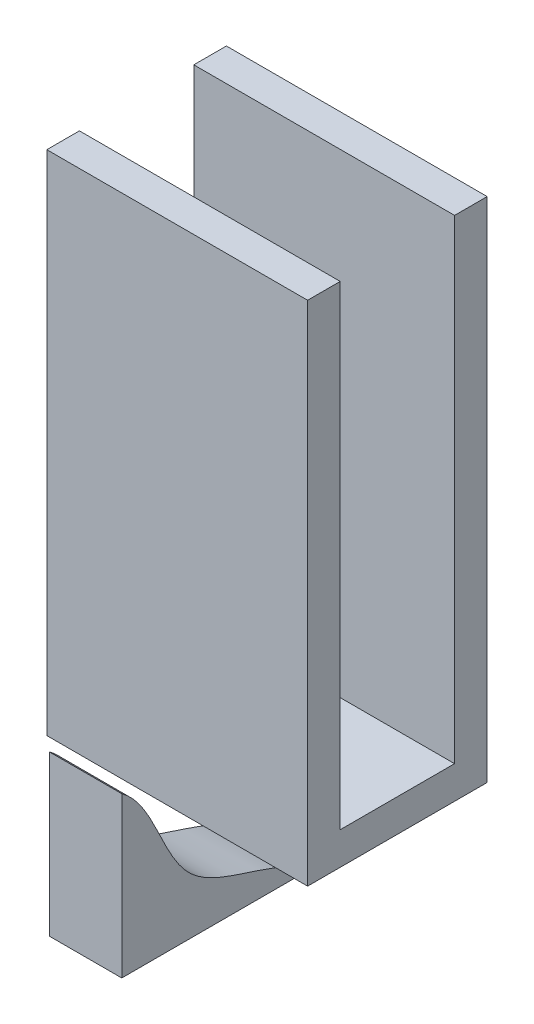
from build123d import *

# Parameters (mm, degrees)
EXTRUDE_5_DEPTH      = 30
EXTRUDE_5_DEPTH_BACK = 30
F_1_FR_R             = 5
EXTRUDE_6_DEPTH      = 20
EXTRUDE_6_DEPTH_BACK = 20
OTHER_START          = -15
OTHER_2_DEPTH        = 30


# Read off the part's stored shape, not the designer's step: Отступ2
with BuildPart() as part:
    # Эскиз1_fr → Бобышка-Вытянуть5 (new, two sides: drawn at the far end of the back side and taken through both)
    with BuildSketch(Plane.XY.offset(-EXTRUDE_5_DEPTH_BACK)):
        with BuildLine():
            Line((-5.557606452, -13.932444528), (-5.557606452, -62.642280008))
            Line((-5.557606452, -62.642280008), (5.557606452, -62.642280008))
            Line((5.557606452, -62.642280008), (5.557606452, -13.932444528))
            ThreePointArc((5.557606452, -13.932444528), (0, 15), (-5.557606452, -13.932444528))
        make_face()
        Circle(F_1_FR_R, mode=Mode.SUBTRACT)
    extrude(amount=EXTRUDE_5_DEPTH + EXTRUDE_5_DEPTH_BACK)

    # Отступ2 outline → Отступ2 (cut)
    with BuildSketch(Plane.YZ.offset(OTHER_START)):
        with BuildLine():
            Line((16, 30), (-38.162129208, 30.000000201))
            add(Edge.make_bspline(
                [(-38.162129208, 30.000000201), (-38.350412386, 29.738589195), (-38.547242858, 29.484853366), (-38.752299072, 29.238505312), (-38.965259498, 28.99925828), (-39.185802485, 28.766826159), (-39.413606123, 28.540923423), (-39.64834813, 28.32126501), (-39.889705768, 28.107566173), (-40.137355811, 27.899542297), (-40.39097457, 27.696908743), (-40.650238001, 27.499380765), (-40.914821881, 27.306673579), (-41.184402075, 27.11850268), (-42.265778691, 26.393314992), (-43.113368902, 25.888872388), (-43.99315142, 25.414009108), (-44.896841535, 24.96146191), (-45.816149017, 24.523958449), (-46.742782565, 24.094220219), (-47.668453227, 23.664962906), (-48.584876381, 23.228895124), (-49.483771918, 22.778716473), (-50.356862203, 22.30711592), (-51.195867455, 21.806771428), (-51.992498133, 21.270351842), (-52.73844395, 20.690521946), (-53.511223517, 19.981130426), (-53.596170911, 19.901516083), (-53.680123568, 19.821092243), (-53.763413941, 19.739889031), (-53.844744398, 19.657606996), (-53.927459143, 19.575304006), (-54.004978314, 19.490233908), (-54.086963112, 19.407352212), (-54.162711198, 19.320126258), (-54.240798044, 19.234583034), (-54.316342943, 19.146873901), (-54.391361142, 19.058753339), (-54.465300564, 18.969694587), (-54.611255963, 18.789935065), (-54.683262919, 18.699224485), (-54.754314107, 18.607695324), (-54.824424506, 18.515359819), (-54.893609092, 18.422230207), (-54.961882842, 18.328318725), (-55.029260732, 18.233637612), (-55.095757741, 18.138199104), (-55.161388843, 18.042015438), (-55.226169019, 17.945098853), (-55.290113242, 17.847461585), (-55.353236491, 17.749115872), (-55.415553743, 17.650073952), (-55.600132437, 17.350896278), (-55.720020886, 17.148708437), (-55.836865309, 16.943882089), (-55.950785669, 16.736514739), (-56.061901911, 16.526703843), (-56.170333957, 16.31454681), (-56.276201707, 16.100141), (-56.379625042, 15.883583727), (-56.480723817, 15.664972254), (-56.579617872, 15.444403799), (-56.676427019, 15.221975529), (-56.771271052, 14.997784566), (-56.864269745, 14.771927983), (-57.138089051, 14.089652446), (-57.313732951, 13.628528404), (-57.48343208, 13.161907014), (-57.648143574, 12.690564713), (-57.808824172, 12.215278032), (-57.966430218, 11.736823601), (-58.121917654, 11.255978148), (-58.276242029, 10.773518498), (-58.430358494, 10.290221572), (-58.585221804, 9.806864391), (-58.741786314, 9.324224071), (-58.901005985, 8.843077827), (-59.063834379, 8.364202972), (-59.410471901, 7.378846098), (-59.594949774, 6.872811052), (-59.785830162, 6.371227061), (-59.984282319, 5.875048562), (-60.19147505, 5.385229705), (-60.408577178, 4.902724584), (-60.636757277, 4.428487146), (-60.877183329, 3.963470844), (-61.131022629, 3.508628159), (-61.399442059, 3.064910118), (-61.683608675, 2.633265954), (-61.984690452, 2.214643016), (-62.303856996, 1.809986968), (-62.642280061, 1.420242276)],
                knots=[0.165052435, 0.165052435, 0.165052435, 0.165052435, 0.165052435, 0.165052435, 0.165052435, 0.165052435, 0.165052435, 0.165052435, 0.165052435, 0.165052435, 0.165052435, 0.165052435, 0.165052435, 0.25, 0.25, 0.25, 0.25, 0.25, 0.25, 0.25, 0.25, 0.25, 0.25, 0.25, 0.25, 0.25, 0.5, 0.5, 0.5, 0.5, 0.5, 0.5, 0.5, 0.5, 0.5, 0.5, 0.5, 0.5, 0.5, 0.53125, 0.53125, 0.53125, 0.53125, 0.53125, 0.53125, 0.53125, 0.53125, 0.53125, 0.53125, 0.53125, 0.53125, 0.53125, 0.5625, 0.5625, 0.5625, 0.5625, 0.5625, 0.5625, 0.5625, 0.5625, 0.5625, 0.5625, 0.5625, 0.5625, 0.5625, 0.625, 0.625, 0.625, 0.625, 0.625, 0.625, 0.625, 0.625, 0.625, 0.625, 0.625, 0.625, 0.625, 0.75, 0.75, 0.75, 0.75, 0.75, 0.75, 0.75, 0.75, 0.75, 0.75, 0.75, 0.75, 0.75, 0.883854275, 0.883854275, 0.883854275, 0.883854275, 0.883854275, 0.883854275, 0.883854275, 0.883854275, 0.883854275, 0.883854275, 0.883854275, 0.883854275, 0.883854275, 0.883854275, 0.883854275], degree=14))
            Line((-62.642280061, 1.420242276), (-62.642280008, -30))
            Line((-62.642280008, -30), (16, -30))
            Line((16, -30), (16, 30))
        make_face()
    extrude(amount=OTHER_2_DEPTH, mode=Mode.SUBTRACT)


with BuildPart() as body_2:
    # Эскиз3 → Бобышка-Вытянуть6 (new, two sides: drawn at the far end of the back side and taken through both)
    with BuildSketch(Plane(origin=(0, 0, 0), x_dir=(0, 0, -1), z_dir=(1, 0, 0)).offset(-EXTRUDE_6_DEPTH_BACK)):
        Polygon((-58.394498043, -50.25314581), (-85.938130262, -50.25314581), (-85.938130262, 27.580465306), (-80.938130262, 27.580465306), (-80.938130262, -45.25314581), (-63.394498043, -45.25314581), (-63.394498043, 27.580465306), (-58.394498043, 27.580465306), align=None)
    extrude(amount=EXTRUDE_6_DEPTH + EXTRUDE_6_DEPTH_BACK)


with BuildPart() as body_2_1:
    # Move Body 1: moved
    add(body_2.part.moved(Location((0, 0, -70))))


solid = Compound([part.part, body_2_1.part])
